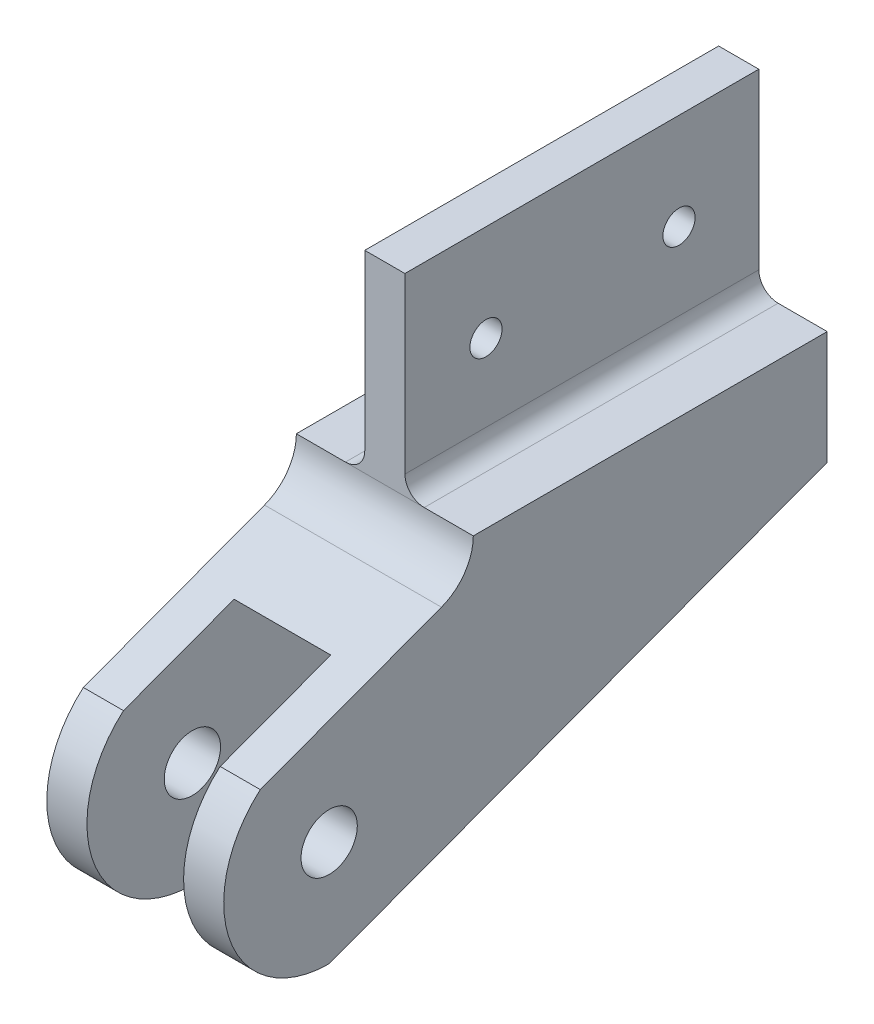
from build123d import *

# Parameters (mm, degrees)
SKETCH1_W           = 69.85
SKETCH1_H           = 38.1
SKETCH1_R           = 3.175
BOSS_EXTRUDE1_DEPTH = 3.9624
BOSS_EXTRUDE2_DEPTH = 17.4625
BOSS_EXTRUDE4_START = 9.5377
SKETCH1_5_R         = 5.55625
BOSS_EXTRUDE4_DEPTH = 7.9248
BOSS_EXTRUDE5_START = -17.4625
SKETCH1_6_R         = 5.55625
BOSS_EXTRUDE5_DEPTH = 7.9248
FILLET1_R           = 3.81


with BuildPart() as part:
    # Sketch1 → Boss-Extrude1 (new, symmetric)
    # profile 1 of 2: a face of its own
    with BuildSketch(Plane(origin=(0, 0, 0), x_dir=(0, 0, -1), z_dir=(1, 0, 0))):
        with Locations((34.925, -19.05)):
            Rectangle(SKETCH1_W, SKETCH1_H)
        with Locations((16.002, -19.05)):
            Circle(SKETCH1_R, mode=Mode.SUBTRACT)
        with Locations((54.102, -19.05)):
            Circle(SKETCH1_R, mode=Mode.SUBTRACT)
    # profile 2 of 2: a face of its own
    with BuildSketch(Plane(origin=(0, 0, 0), x_dir=(0, 0, -1), z_dir=(1, 0, 0))):
        with BuildLine():
            Line((69.85, -38.1), (0, -38.1))
            ThreePointArc((0, -38.1), (-1.726202144, -43.608432839), (-6.287366834, -47.146565517))
            Line((-6.287366834, -47.146565517), (-20.208052372, -52.324))
            Line((-20.208052372, -52.324), (69.85, -52.324))
            Line((69.85, -52.324), (69.85, -38.1))
        make_face()
    extrude(amount=BOSS_EXTRUDE1_DEPTH, both=True)

    # Sketch1<3> → Boss-Extrude2 (add, symmetric)
    with BuildSketch(Plane(origin=(0, 0, 0), x_dir=(0, 0, -1), z_dir=(1, 0, 0))):
        with BuildLine():
            Line((69.85, -38.1), (0, -38.1))
            ThreePointArc((0, -38.1), (-1.726202144, -43.608432839), (-6.287366834, -47.146565517))
            Line((-6.287366834, -47.146565517), (-20.208052372, -52.324))
            Line((-20.208052372, -52.324), (69.85, -52.324))
            Line((69.85, -52.324), (69.85, -38.1))
        make_face()
    extrude(amount=BOSS_EXTRUDE2_DEPTH, both=True)

    # Sketch1<5> → Boss-Extrude4 (add)
    with BuildSketch(Plane(origin=(0, 0, 0), x_dir=(0, 0, -1), z_dir=(1, 0, 0)).offset(BOSS_EXTRUDE4_START)):
        with BuildLine():
            Line((69.85, -60.452), (69.85, -52.324))
            Line((69.85, -52.324), (-20.208052372, -52.324))
            Line((-20.208052372, -52.324), (-28.448, -55.388632763))
            Line((-28.448, -55.388632763), (-42.047327619, -60.446546582))
            ThreePointArc((-42.047327619, -60.446546582), (-47.953946665, -83.454726113), (-28.448, -97.011367237))
            Line((-28.448, -97.011367237), (69.85, -60.452))
        make_face()
        with Locations((-28.448, -76.2)):
            Circle(SKETCH1_5_R, mode=Mode.SUBTRACT)
    extrude(amount=BOSS_EXTRUDE4_DEPTH)

    # Sketch1<6> → Boss-Extrude5 (add)
    with BuildSketch(Plane(origin=(0, 0, 0), x_dir=(0, 0, -1), z_dir=(1, 0, 0)).offset(BOSS_EXTRUDE5_START)):
        with BuildLine():
            Line((69.85, -60.452), (69.85, -52.324))
            Line((69.85, -52.324), (-20.208052372, -52.324))
            Line((-20.208052372, -52.324), (-28.448, -55.388632763))
            Line((-28.448, -55.388632763), (-42.047327619, -60.446546582))
            ThreePointArc((-42.047327619, -60.446546582), (-47.953946665, -83.454726113), (-28.448, -97.011367237))
            Line((-28.448, -97.011367237), (69.85, -60.452))
        make_face()
        with Locations((-28.448, -76.2)):
            Circle(SKETCH1_6_R, mode=Mode.SUBTRACT)
    extrude(amount=BOSS_EXTRUDE5_DEPTH)

    # Fillet1
    # the kernel refuses this fillet: 3.81 mm, written as the material it adds along each edge
    with BuildSketch(Plane(origin=(-3.9624, -38.1, -69.85), x_dir=(-1, 0, 0), z_dir=(0, 0, 1))) as fillet1_piece_1:
        with BuildLine():
            CenterArc((FILLET1_R, -FILLET1_R), FILLET1_R, 90, 90)
            Line((0, -FILLET1_R), (0, 0))
            Line((0, 0), (FILLET1_R, 0))
        make_face()
    extrude(amount=69.85)
    with BuildSketch(Plane(origin=(3.9624, -38.1, -69.85), x_dir=(1, 0, 0), z_dir=(0, 0, 1))) as fillet1_piece_2:
        with BuildLine():
            CenterArc((FILLET1_R, FILLET1_R), FILLET1_R, 180, 90)
            Line((0, FILLET1_R), (0, 0))
            Line((0, 0), (FILLET1_R, 0))
        make_face()
    extrude(amount=69.85)


solid = part.part
